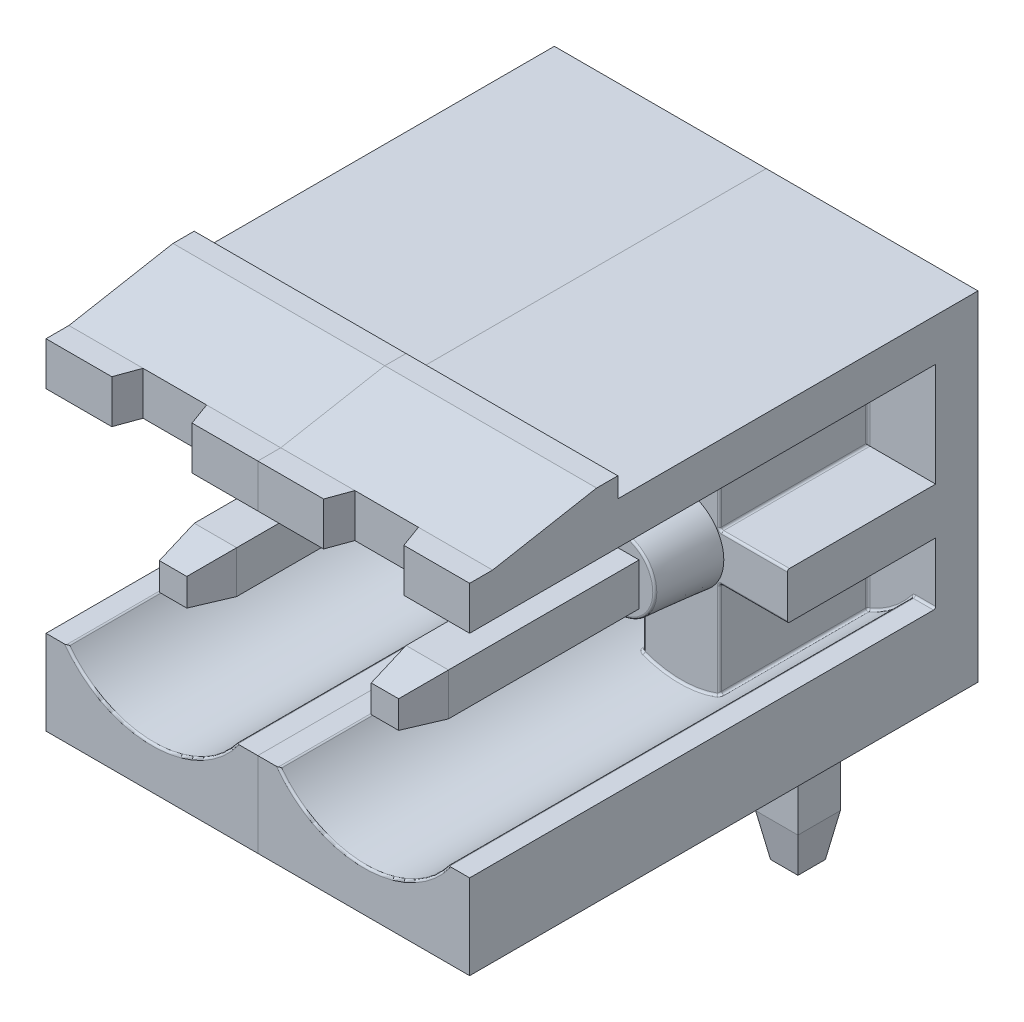
from build123d import *
from OCP.BRepFilletAPI import BRepFilletAPI_MakeChamfer

# Parameters (mm, degrees)
SKETCH_1_W                   = 5
SKETCH_1_H                   = 8
EXTRUDE_1_DEPTH              = 12
SKETCH_2_W                   = 5
SKETCH_2_H                   = 5
CUT_EXTRUDE_2_DEPTH          = 11
SKETCH_5_R                   = 2.5
CUT_EXTRUDE_3_DEPTH          = 11
EXTRUDE_START                = 3.5
SKETCH_13_W                  = 1.8
SKETCH_13_H                  = 1.1
SKETCH_13_H_2                = 2.45
SKETCH_13_W_2                = 1.6
EXTRUDE_13_DEPTH             = 3.5
SKETCH_14_R                  = 1
EXTRUDE_14_DEPTH             = 1.5
CHAMFER_1_SIZE               = 1.5
CHAMFER_1_SIZE_2             = 0.131232995
EXTRUDE_15_DEPTH             = 5
CUT_EXTRUDE_16_REACH         = 16.649
SKETCH_17_W                  = 1.2
SKETCH_17_H                  = 5
CUT_EXTRUDE_17_DEPTH         = 2.25
SKETCH_18_W                  = 3.5
SKETCH_18_H                  = 6
CUT_EXTRUDE_18_DEPTH         = 0.1
EXTRUDE_19_REACH             = 16.9
SKETCH_6_W                   = 1
SKETCH_6_H                   = 1
SKETCH_19_W                  = 1
SKETCH_19_H                  = 1
CUT_EXTRUDE_20_DEPTH         = 0.5
EXTRUDE_22_REACH             = 16.9
SKETCH_9_W                   = 1
SKETCH_9_H                   = 1
EXTRUDE_22_DIRECTION_2_DEPTH = 4
CHAMFER_2_SIZE               = 1
CHAMFER_2_SIZE2              = 0.176326981
CHAMFER_3_SIZE               = 1
CHAMFER_3_SIZE2              = 0.176326981
FILLET_3_R                   = 0.05
PATTERN_LINEAR_1_COUNT       = 2
PATTERN_LINEAR_1_PITCH       = 5


with BuildPart() as part:
    # Эскиз1 → Вытянуть1 (new body)
    with BuildSketch(Plane.XY):
        with Locations((0, 4)):
            Rectangle(SKETCH_1_W, SKETCH_1_H)
    extrude(amount=EXTRUDE_1_DEPTH)

    # Эскиз2 → Вытянуть2 (cut)
    with BuildSketch(Plane.XY.offset(12)):
        with Locations((0, 4.5)):
            Rectangle(SKETCH_2_W, SKETCH_2_H)
    extrude(amount=-CUT_EXTRUDE_2_DEPTH, mode=Mode.SUBTRACT)

    # Эскиз5 → Вытянуть3 (cut)
    with BuildSketch(Plane.XY.offset(12)):
        with Locations((0, 3.5)):
            Circle(SKETCH_5_R)
    extrude(amount=-CUT_EXTRUDE_3_DEPTH, mode=Mode.SUBTRACT)

    # Эскиз13 → Вытянуть13 (add)
    with BuildSketch(Plane.XY.offset(1).offset(EXTRUDE_START)):
        with Locations((0, 4)):
            Rectangle(SKETCH_13_W, SKETCH_13_H)
        with Locations((0, 5.775)):
            Rectangle(SKETCH_13_W, SKETCH_13_H_2)
        with Locations((-1.7, 4)):
            Rectangle(SKETCH_13_W_2, SKETCH_13_H)
        with BuildLine():
            ThreePointArc((-0.9, 1.167619242), (-0.457737974, 1.042262026), (0, 1))
            ThreePointArc((0, 1), (0.457737974, 1.042262026), (0.9, 1.167619242))
            Line((0.9, 1.167619242), (0.9, 3.45))
            Line((0.9, 3.45), (-0.9, 3.45))
            Line((-0.9, 3.45), (-0.9, 1.167619242))
        make_face()
        with Locations((1.7, 4)):
            Rectangle(SKETCH_13_W_2, SKETCH_13_H)
    extrude(amount=-EXTRUDE_13_DEPTH)

    # Эскиз14 → Вытянуть14 (add)
    with BuildSketch(Plane.XY.offset(4.5)):
        with Locations((0, 4)):
            Circle(SKETCH_14_R)
    extrude(amount=EXTRUDE_14_DEPTH)

    # Фаска1
    # the kernel refuses this chamfer: 1.5, 0.131232995 mm, written as the material it takes off along each edge
    with BuildSketch(Plane(origin=(0, 4, 6), x_dir=(1, 0, 0), z_dir=(0, -1, 0))) as chamfer_1_piece_1_section:
        Polygon((1, -CHAMFER_1_SIZE), (1 - CHAMFER_1_SIZE_2 * 1.0000000022, 0), (1, 0), align=None)
    chamfer_1_piece_1 = revolve(axis=Axis((0, 4, 6), (0, 0, 1)), mode=Mode.PRIVATE)
    chamfer_1_piece_1 = split(chamfer_1_piece_1, bisect_by=Plane(origin=(-0.941450204, 4, 4.5), z_dir=(0, 0, 1)), keep=Keep.TOP, mode=Mode.PRIVATE)
    add(chamfer_1_piece_1, mode=Mode.SUBTRACT)

    # Эскиз15 → Вытянуть15 (add)
    with BuildSketch(Plane(origin=(2.5, 0, 0), x_dir=(0, 0, -1), z_dir=(1, 0, 0))):
        Polygon((-12, 8), (-8.502371568, 8), (-8.502371568, 8.471155216), (-9.002629656, 8.471155216), (-11.45875482, 8.021948415), (-12, 8.021948415), align=None)
    extrude(amount=-EXTRUDE_15_DEPTH)

    # Эскиз16 → Вытянуть16 (cut, up to next)
    with BuildSketch(Plane(origin=(0, 8.021948415, 0), x_dir=(1, 0, 0), z_dir=(0, 1, 0)), mode=Mode.PRIVATE) as cut_extrude_16_sk1:
        Polygon((0.75, -11.45875482), (-0.75, -11.45875482), (-0.946997135, -12), (0.946997135, -12), align=None)
    cut_extrude_16_tool1 = extrude(cut_extrude_16_sk1.sketch, amount=-CUT_EXTRUDE_16_REACH, mode=Mode.PRIVATE) & part.part
    add(cut_extrude_16_tool1.solids().sort_by_distance((0, 8.021948, 11.739849))[0], mode=Mode.SUBTRACT)

    # Эскиз17 → Вытянуть17 (cut)
    with BuildSketch(Plane(origin=(0, 0, 0), x_dir=(-1, 0, 0), z_dir=(0, 0, -1))):
        with Locations((0, 2.5)):
            Rectangle(SKETCH_17_W, SKETCH_17_H)
    extrude(amount=-CUT_EXTRUDE_17_DEPTH, mode=Mode.SUBTRACT)

    # Эскиз18 → Вытянуть18 (cut)
    with BuildSketch(Plane(origin=(0, 0, 0), x_dir=(-1, 0, 0), z_dir=(0, 0, -1))):
        with Locations((0, 3)):
            Rectangle(SKETCH_18_W, SKETCH_18_H)
    extrude(amount=-CUT_EXTRUDE_18_DEPTH, mode=Mode.SUBTRACT)


with BuildPart() as body_2:

    # Эскиз6 → Вытянуть19 (new, up to next)
    with BuildSketch(Plane.XY.offset(12), mode=Mode.PRIVATE) as extrude_19_sk1:
        with Locations((0, 4)):
            Rectangle(SKETCH_6_W, SKETCH_6_H)
    extrude_19_tool1 = extrude(extrude_19_sk1.sketch, amount=-EXTRUDE_19_REACH, mode=Mode.PRIVATE) - part.part
    add(extrude_19_tool1.solids().sort_by_distance((0, 4, 12))[0])

    # Эскиз19 → Вытянуть20 (cut)
    with BuildSketch(Plane.XY.offset(12)):
        with Locations((0, 4)):
            Rectangle(SKETCH_19_W, SKETCH_19_H)
    extrude(amount=-CUT_EXTRUDE_20_DEPTH, mode=Mode.SUBTRACT)

    # Фаска2: one chamfer whose edges measure the first distance from different faces: ONE call of the kernel's chamfer builder (chamfer() names one face for all edges)
    chamfer_2_edges_1 = [body_2.edges().sort_by_distance(p)[0] for p in [
        (-0.5, 4, 11.5),
    ]]
    chamfer_2_side_1 = [body_2.faces().sort_by_distance(p)[0] for p in [
        (-0.5, 4, 8.75),
    ]]
    chamfer_2_edges_2 = [body_2.edges().sort_by_distance(p)[0] for p in [
        (0, 4.5, 11.5),
    ]]
    chamfer_2_side_2 = [body_2.faces().sort_by_distance(p)[0] for p in [
        (0, 4.5, 8.75),
    ]]
    chamfer_2_edges_3 = [body_2.edges().sort_by_distance(p)[0] for p in [
        (0.5, 4, 11.5),
    ]]
    chamfer_2_side_3 = [body_2.faces().sort_by_distance(p)[0] for p in [
        (0.5, 4, 8.75),
    ]]
    chamfer_2_edges_4 = [body_2.edges().sort_by_distance(p)[0] for p in [
        (0, 3.5, 11.5),
    ]]
    chamfer_2_side_4 = [body_2.faces().sort_by_distance(p)[0] for p in [
        (0, 3.5, 8.75),
    ]]
    chamfer_2 = BRepFilletAPI_MakeChamfer(body_2.part.solid().wrapped)
    for e in chamfer_2_edges_1:
        chamfer_2.Add(CHAMFER_2_SIZE, CHAMFER_2_SIZE2, e.wrapped, chamfer_2_side_1[0].wrapped)  # the first distance lies on this face
    for e in chamfer_2_edges_2:
        chamfer_2.Add(CHAMFER_2_SIZE, CHAMFER_2_SIZE2, e.wrapped, chamfer_2_side_2[0].wrapped)  # the first distance lies on this face
    for e in chamfer_2_edges_3:
        chamfer_2.Add(CHAMFER_2_SIZE, CHAMFER_2_SIZE2, e.wrapped, chamfer_2_side_3[0].wrapped)  # the first distance lies on this face
    for e in chamfer_2_edges_4:
        chamfer_2.Add(CHAMFER_2_SIZE, CHAMFER_2_SIZE2, e.wrapped, chamfer_2_side_4[0].wrapped)  # the first distance lies on this face
    add(Compound.cast(chamfer_2.Shape()), mode=Mode.REPLACE)


with BuildPart() as body_3:

    # Эскиз9 → Вытянуть22 (new, up to next)
    with BuildSketch(Plane.XZ, mode=Mode.PRIVATE) as extrude_22_sk1:
        with Locations((0, 1.75)):
            Rectangle(SKETCH_9_W, SKETCH_9_H)
    extrude_22_tool1 = extrude(extrude_22_sk1.sketch, amount=-EXTRUDE_22_REACH, mode=Mode.PRIVATE) - part.part
    add(extrude_22_tool1.solids().sort_by_distance((0, 0, 1.75))[0])

    # Эскиз9 → Вытянуть22 direction 2 (add)
    with BuildSketch(Plane.XZ):
        with Locations((0, 1.75)):
            Rectangle(SKETCH_9_W, SKETCH_9_H)
    extrude(amount=EXTRUDE_22_DIRECTION_2_DEPTH)

    # Фаска3: one chamfer whose edges measure the first distance from different faces: ONE call of the kernel's chamfer builder (chamfer() names one face for all edges)
    chamfer_3_edges_1 = [body_3.edges().sort_by_distance(p)[0] for p in [
        (-0.5, -4, 1.75),
    ]]
    chamfer_3_side_1 = [body_3.faces().sort_by_distance(p)[0] for p in [
        (-0.5, 0.5, 1.75),
    ]]
    chamfer_3_edges_2 = [body_3.edges().sort_by_distance(p)[0] for p in [
        (0, -4, 1.25),
    ]]
    chamfer_3_side_2 = [body_3.faces().sort_by_distance(p)[0] for p in [
        (0, 0.5, 1.25),
    ]]
    chamfer_3_edges_3 = [body_3.edges().sort_by_distance(p)[0] for p in [
        (0.5, -4, 1.75),
    ]]
    chamfer_3_side_3 = [body_3.faces().sort_by_distance(p)[0] for p in [
        (0.5, 0.5, 1.75),
    ]]
    chamfer_3_edges_4 = [body_3.edges().sort_by_distance(p)[0] for p in [
        (0, -4, 2.25),
    ]]
    chamfer_3_side_4 = [body_3.faces().sort_by_distance(p)[0] for p in [
        (0, 0.5, 2.25),
    ]]
    chamfer_3 = BRepFilletAPI_MakeChamfer(body_3.part.solid().wrapped)
    for e in chamfer_3_edges_1:
        chamfer_3.Add(CHAMFER_3_SIZE, CHAMFER_3_SIZE2, e.wrapped, chamfer_3_side_1[0].wrapped)  # the first distance lies on this face
    for e in chamfer_3_edges_2:
        chamfer_3.Add(CHAMFER_3_SIZE, CHAMFER_3_SIZE2, e.wrapped, chamfer_3_side_2[0].wrapped)  # the first distance lies on this face
    for e in chamfer_3_edges_3:
        chamfer_3.Add(CHAMFER_3_SIZE, CHAMFER_3_SIZE2, e.wrapped, chamfer_3_side_3[0].wrapped)  # the first distance lies on this face
    for e in chamfer_3_edges_4:
        chamfer_3.Add(CHAMFER_3_SIZE, CHAMFER_3_SIZE2, e.wrapped, chamfer_3_side_4[0].wrapped)  # the first distance lies on this face
    add(Compound.cast(chamfer_3.Shape()), mode=Mode.REPLACE)


with BuildPart() as part_1:
    add(part.part)

    # Скругление3
    fillet_3_edges = [part_1.edges().sort_by_distance(p)[0] for p in [
        (-2.25, 2, 1),
        (2.25, 2, 1),
        (0, 1, 12),
        (-1.508547126, 1.506438973, 1),
        (2, 2, 6.5),
        (-2, 2, 6.5),
        (1.508547126, 1.506438973, 1),
        (-0.9, 5.775, 4.5),
        (-0.9, 7, 2.75),
        (-1.7, 4.55, 4.5),
        (-0.9, 4.55, 2.75),
        (-0.9, 2.308809621, 4.5),
        (-0.9, 3.45, 2.75),
        (-0.9, 1.167619242, 2.75),
        (0.9, 2.308809621, 1),
        (0.9, 1.167619242, 2.75),
        (0.9, 3.45, 2.75),
        (1.7, 4.55, 4.5),
        (0.9, 5.775, 1),
        (0.9, 4.55, 2.75),
        (0.9, 7, 2.75),
        (-1.7, 3.45, 4.5),
        (0, 1, 4.5),
        (0.9, 2.308809621, 4.5),
        (1.7, 3.45, 4.5),
        (0.9, 5.775, 4.5),
        (0, 7, 4.5),
        (-0.9, 5.775, 1),
        (-0.9, 2.308809621, 1),
        (-0.868767005, 4, 6),
    ]]
    fillet(fillet_3_edges, radius=FILLET_3_R)


with BuildPart() as pattern_linear_1_1:
    # Линейный массив1: pattern copy
    add(body_3.part.moved(Location(Vector(1, 0, 0) * (1 * PATTERN_LINEAR_1_PITCH))))


with BuildPart() as pattern_linear_1_2:
    # Линейный массив1: pattern copy
    add(body_2.part.moved(Location(Vector(1, 0, 0) * (1 * PATTERN_LINEAR_1_PITCH))))


with BuildPart() as pattern_linear_1_3:
    # Линейный массив1: pattern copy
    add(part_1.part.moved(Location(Vector(1, 0, 0) * (1 * PATTERN_LINEAR_1_PITCH))))


solid = Compound([body_2.part, body_3.part, part_1.part, pattern_linear_1_1.part, pattern_linear_1_2.part, pattern_linear_1_3.part])
